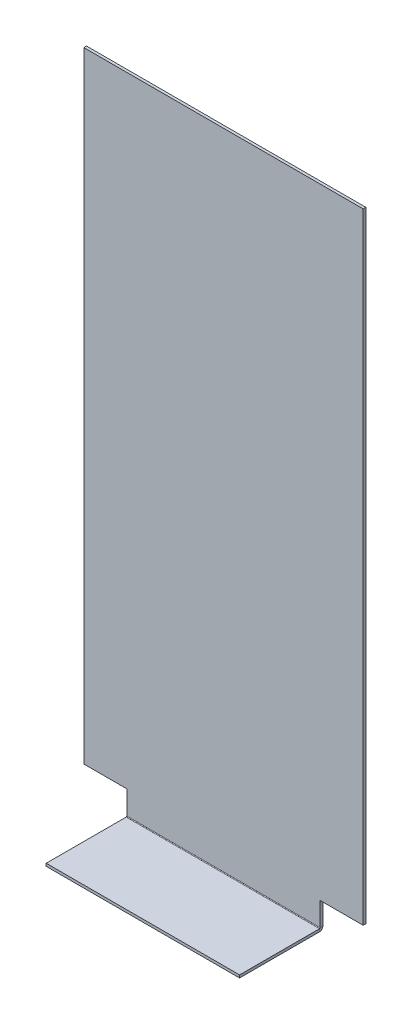
from build123d import *

# Parameters (mm, degrees)
BASE_FLANGE1_DEPTH = 114.3
SKETCH6_W          = 50.8
SKETCH6_H          = 733.425
TAB1_DEPTH         = 3.175


# Sheet-metal steps are written as plain solids
with BuildPart() as part:
    # Sketch1 → Base-Flange1 (new, symmetric)
    with BuildSketch(Plane(origin=(0, 0, 0), x_dir=(0, 0, -1), z_dir=(1, 0, 0))):
        with BuildLine():
            Line((-95.25, 0), (-0.7366, 0))
            ThreePointArc((-0.7366, 0), (-0.215745145, 0.215745145), (0, 0.7366))
            Line((0, 0.7366), (0, 762))
            Line((0, 762), (3.175, 762))
            Line((3.175, 762), (3.175, 0.7366))
            ThreePointArc((3.175, 0.7366), (2.029318885, -2.029318885), (-0.7366, -3.175))
            Line((-0.7366, -3.175), (-95.25, -3.175))
            Line((-95.25, -3.175), (-95.25, 0))
        make_face()
    extrude(amount=BASE_FLANGE1_DEPTH, both=True)

    # Sketch6 → Tab1 (add)
    with BuildSketch(Plane(origin=(0, 0, -3.175), x_dir=(-1, 0, 0), z_dir=(0, 0, -1))):
        with Locations((-139.7, 395.2875)):
            Rectangle(SKETCH6_W, SKETCH6_H)
        with Locations((139.7, 395.2875)):
            Rectangle(SKETCH6_W, SKETCH6_H)
    extrude(amount=-TAB1_DEPTH)


solid = part.part
